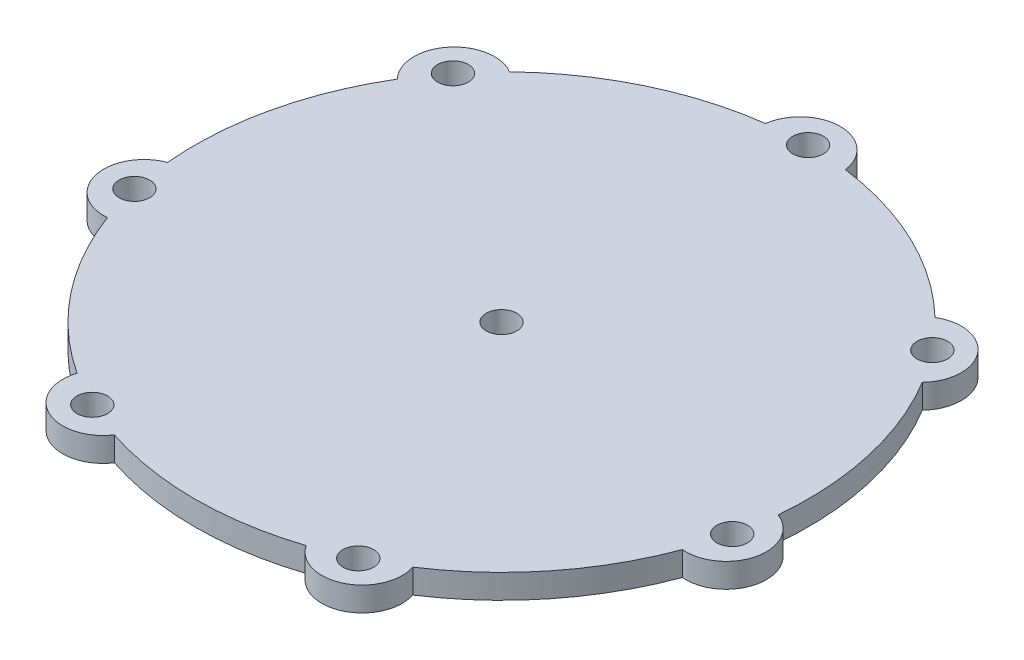
from build123d import *

# Parameters (mm, degrees)
SKETCH1_R           = 38
BOSS_EXTRUDE6_DEPTH = 7
SKETCH3_R           = 38
SKETCH3_R_2         = 35
BOSS_EXTRUDE7_DEPTH = 24
CIRPATTERN1_COUNT   = 24
BOSS_EXTRUDE8_DEPTH = 31
SKETCH6_3_R         = 1.9
CUT_EXTRUDE1_DEPTH  = 31
CIRPATTERN2_COUNT   = 7
BOSS_EXTRUDE9_DEPTH = 7
SKETCH8_R           = 1.9
CUT_EXTRUDE2_DEPTH  = 14
SKETCH9_R           = 42
PART1_DEPTH         = 28


with BuildPart() as part:
    # Sketch1 → Boss-Extrude6 (new body)
    with BuildSketch(Plane(origin=(0, 0, 0), x_dir=(1, 0, 0), z_dir=(0, 1, 0))):
        with Locations(Location((0, 0, 0), (0, 0, 270))):
            Circle(SKETCH1_R)
    extrude(amount=BOSS_EXTRUDE6_DEPTH)

    # Sketch3 → Boss-Extrude7 (add)
    with BuildSketch(Plane(origin=(0, 7, 0), x_dir=(1, 0, 0), z_dir=(0, 1, 0))):
        with Locations(Location((0, 0, 0), (0, 0, 270))):
            Circle(SKETCH3_R)
        with Locations(Location((0, 0, 0), (0, 0, 270))):
            Circle(SKETCH3_R_2, mode=Mode.SUBTRACT)
    extrude(amount=BOSS_EXTRUDE7_DEPTH)

    # Sketch4 → Loft1 section 0
    with BuildSketch(Plane(origin=(0, 7, 0), x_dir=(1, 0, 0), z_dir=(0, 1, 0))):
        with BuildLine():
            Line((1, 33), (-1, 33))
            Line((-1, 33), (-3.355280929, 36))
            Line((-3.355280929, 36), (3.355280929, 36))
            Line((3.355280929, 36), (1, 33))
        make_face()
    # Sketch5 → Loft1 section 1
    with BuildSketch(Plane(origin=(0, 19, 0), x_dir=(0.9889879611668934, 0, 0.147995988685341), z_dir=(0, 1, 0))):
        with BuildLine():
            Line((1, 33), (-1, 33))
            Line((-1, 33), (-3.355280929, 36))
            Line((-3.355280929, 36), (3.355280929, 36))
            Line((3.355280929, 36), (1, 33))
        make_face()
    loft1 = loft()

    # CirPattern1: Loft1 ×24 about axis
    cirpattern1_axis = Axis((0, 7, 0), (0, -1, 0))
    for i in range(1, CIRPATTERN1_COUNT):
        add(loft1.rotate(cirpattern1_axis, i * 360 / CIRPATTERN1_COUNT))

    # Mirror1: read off the stored shape, not the designer's step
    # Mirror1: loft between two sections, ruled curve by curve
    mirror1_from = [
        Edge.make_bspline([(-1, 31, -33), (-0.666666667, 31, -33), (-0.333333333, 31, -33), (0.333333333, 31, -33), (0.666666667, 31, -33), (1, 31, -33)], [0, 0, 0, 0, 0.5, 0.5, 1, 1, 1, 1], 3),
        Edge.make_bspline([(1, 31, -33), (1.392546821, 31, -33.5), (1.785093643, 31, -34), (2.570187286, 31, -35), (2.962734107, 31, -35.5), (3.355280929, 31, -36)], [0, 0, 0, 0, 0.5, 0.5, 1, 1, 1, 1], 3),
        Edge.make_bspline([(-3.355280929, 31, -36), (-2.962734107, 31, -35.5), (-2.570187286, 31, -35), (-1.785093643, 31, -34), (-1.392546821, 31, -33.5), (-1, 31, -33)], [0, 0, 0, 0, 0.5, 0.5, 1, 1, 1, 1], 3),
        Edge.make_line((-3.355280929, 31, -36), (3.355280929, 31, -36)),
    ]
    mirror1_to = [
        Edge.make_bspline([(3.894879665, 19, -32.784598707), (4.224542319, 19, -32.735266711), (4.554204973, 19, -32.685934715), (5.21353028, 19, -32.587270722), (5.543192934, 19, -32.537938726), (5.872855588, 19, -32.48860673)], [0, 0, 0, 0, 0.5, 0.5, 1, 1, 1, 1], 3),
        Edge.make_bspline([(5.872855588, 19, -32.48860673), (6.335077663, 19, -32.925005355), (6.797299738, 19, -33.361403981), (7.721743888, 19, -34.234201232), (8.183965962, 19, -34.670599858), (8.646188037, 19, -35.106998484)], [0, 0, 0, 0, 0.5, 0.5, 1, 1, 1, 1], 3),
        Edge.make_bspline([(2.009523148, 19, -36.10013472), (2.323749234, 19, -35.547545385), (2.63797532, 19, -34.994956049), (3.266427493, 19, -33.889777378), (3.580653579, 19, -33.337188043), (3.894879665, 19, -32.784598707)], [0, 0, 0, 0, 0.5, 0.5, 1, 1, 1, 1], 3),
        Edge.make_line((2.009523148, 19, -36.10013472), (8.646188037, 19, -35.106998484)),
    ]
    mirror1 = Solid(Shell([*[Face.make_surface_from_curves(mirror1_from[k], mirror1_to[k]) for k in range(4)], Face(Wire(mirror1_from)), Face(Wire(mirror1_to))]))
    add(mirror1)

    # Mirror1 2: loft between two sections, ruled curve by curve
    mirror1_2_from = [
        Edge.make_bspline([(7.575102662, 31, -32.134371313), (7.897077938, 31, -32.048098298), (8.219053213, 31, -31.961825283), (8.863003764, 31, -31.789279253), (9.184979039, 31, -31.703006237), (9.506954315, 31, -31.616733222)], [0, 0, 0, 0, 0.5, 0.5, 1, 1, 1, 1], 3),
        Edge.make_bspline([(9.506954315, 31, -31.616733222), (10.01553495, 31, -31.998097542), (10.524115585, 31, -32.379461862), (11.541276856, 31, -33.142190501), (12.049857492, 31, -33.523554821), (12.558438127, 31, -33.90491914)], [0, 0, 0, 0, 0.5, 0.5, 1, 1, 1, 1], 3),
        Edge.make_bspline([(6.07653312, 31, -35.641740352), (6.326294711, 31, -35.057178846), (6.576056301, 31, -34.472617339), (7.075579481, 31, -33.303494326), (7.325341072, 31, -32.718932819), (7.575102662, 31, -32.134371313)], [0, 0, 0, 0, 0.5, 0.5, 1, 1, 1, 1], 3),
        Edge.make_line((6.07653312, 31, -35.641740352), (12.558438127, 31, -33.90491914)),
    ]
    mirror1_2_to = [
        Edge.make_bspline([(12.247443391, 19, -30.65942156), (12.553105002, 19, -30.526447538), (12.858766613, 19, -30.393473515), (13.470089835, 19, -30.12752547), (13.775751446, 19, -29.994551448), (14.081413057, 19, -29.861577425)], [0, 0, 0, 0, 0.5, 0.5, 1, 1, 1, 1], 3),
        Edge.make_bspline([(14.081413057, 19, -29.861577425), (14.640833572, 19, -30.163474252), (15.200254087, 19, -30.465371079), (16.319095118, 19, -31.069164733), (16.878515633, 19, -31.37106156), (17.437936148, 19, -31.672958387)], [0, 0, 0, 0, 0.5, 0.5, 1, 1, 1, 1], 3),
        Edge.make_bspline([(11.284452703, 19, -34.349949597), (11.444951151, 19, -33.734861591), (11.605449599, 19, -33.119773584), (11.926446495, 19, -31.889597572), (12.086944943, 19, -31.274509566), (12.247443391, 19, -30.65942156)], [0, 0, 0, 0, 0.5, 0.5, 1, 1, 1, 1], 3),
        Edge.make_line((11.284452703, 19, -34.349949597), (17.437936148, 19, -31.672958387)),
    ]
    mirror1_2 = Solid(Shell([*[Face.make_surface_from_curves(mirror1_2_from[k], mirror1_2_to[k]) for k in range(4)], Face(Wire(mirror1_2_from)), Face(Wire(mirror1_2_to))]))
    add(mirror1_2)

    # Mirror1 3: loft between two sections, ruled curve by curve
    mirror1_3_from = [
        Edge.make_bspline([(15.633974596, 31, -29.078838325), (15.922649731, 31, -28.912171658), (16.211324865, 31, -28.745504992), (16.788675135, 31, -28.412171658), (17.077350269, 31, -28.245504992), (17.366025404, 31, -28.078838325)], [0, 0, 0, 0, 0.5, 0.5, 1, 1, 1, 1], 3),
        Edge.make_bspline([(17.366025404, 31, -28.078838325), (17.955980923, 31, -28.315577616), (18.545936443, 31, -28.552316907), (19.725847482, 31, -29.02579549), (20.315803002, 31, -29.262534781), (20.905758521, 31, -29.499274072)], [0, 0, 0, 0, 0.5, 0.5, 1, 1, 1, 1], 3),
        Edge.make_bspline([(15.094241479, 31, -32.854555001), (15.184196998, 31, -32.225268888), (15.274152518, 31, -31.595982775), (15.454063557, 31, -30.33741055), (15.544019077, 31, -29.708124437), (15.633974596, 31, -29.078838325)], [0, 0, 0, 0, 0.5, 0.5, 1, 1, 1, 1], 3),
        Edge.make_line((15.094241479, 31, -32.854555001), (20.905758521, 31, -29.499274072)),
    ]
    mirror1_3_to = [
        Edge.make_bspline([(19.765364089, 19, -26.444855501), (20.026194323, 19, -26.237301412), (20.287024558, 19, -26.029747323), (20.808685027, 19, -25.614639145), (21.069515262, 19, -25.407085057), (21.330345497, 19, -25.199530968)], [0, 0, 0, 0, 0.5, 0.5, 1, 1, 1, 1], 3),
        Edge.make_bspline([(21.330345497, 19, -25.199530968), (21.948840869, 19, -25.346352226), (22.567336241, 19, -25.493173485), (23.804326984, 19, -25.786816002), (24.422822356, 19, -25.93363726), (25.041317728, 19, -26.080458519)], [0, 0, 0, 0, 0.5, 0.5, 1, 1, 1, 1], 3),
        Edge.make_bspline([(19.790365456, 19, -30.258872174), (19.786198561, 19, -29.623202728), (19.782031667, 19, -28.987533283), (19.773697878, 19, -27.716194392), (19.769530983, 19, -27.080524946), (19.765364089, 19, -26.444855501)], [0, 0, 0, 0, 0.5, 0.5, 1, 1, 1, 1], 3),
        Edge.make_line((19.790365456, 19, -30.258872174), (25.041317728, 19, -26.080458519)),
    ]
    mirror1_3 = Solid(Shell([*[Face.make_surface_from_curves(mirror1_3_from[k], mirror1_3_to[k]) for k in range(4)], Face(Wire(mirror1_3_from)), Face(Wire(mirror1_3_to))]))
    add(mirror1_3)

    # Mirror1 4: loft between two sections, ruled curve by curve
    mirror1_4_from = [
        Edge.make_bspline([(22.627416998, 31, -24.04163056), (22.863119258, 31, -23.8059283), (23.098821519, 31, -23.57022604), (23.57022604, 31, -23.098821519), (23.8059283, 31, -22.863119258), (24.04163056, 31, -22.627416998)], [0, 0, 0, 0, 0.5, 0.5, 1, 1, 1, 1], 3),
        Edge.make_bspline([(24.04163056, 31, -22.627416998), (24.67275647, 31, -22.703397869), (25.30388238, 31, -22.77937874), (26.5661342, 31, -22.931340483), (27.19726011, 31, -23.007321354), (27.82838602, 31, -23.083302225)], [0, 0, 0, 0, 0.5, 0.5, 1, 1, 1, 1], 3),
        Edge.make_bspline([(23.083302225, 31, -27.82838602), (23.007321354, 31, -27.19726011), (22.931340483, 31, -26.5661342), (22.77937874, 31, -25.30388238), (22.703397869, 31, -24.67275647), (22.627416998, 31, -24.04163056)], [0, 0, 0, 0, 0.5, 0.5, 1, 1, 1, 1], 3),
        Edge.make_line((23.083302225, 31, -27.82838602), (27.82838602, 31, -23.083302225)),
    ]
    mirror1_4_to = [
        Edge.make_bspline([(25.936307888, 19, -20.428116241), (26.134531597, 19, -20.160126554), (26.332755305, 19, -19.892136867), (26.729202723, 19, -19.356157493), (26.927426432, 19, -19.088167806), (27.125650141, 19, -18.820178119)], [0, 0, 0, 0, 0.5, 0.5, 1, 1, 1, 1], 3),
        Edge.make_bspline([(27.125650141, 19, -18.820178119), (27.761070932, 19, -18.801918183), (28.396491723, 19, -18.783658247), (29.667333305, 19, -18.747138374), (30.302754096, 19, -18.728878438), (30.938174888, 19, -18.710618502)], [0, 0, 0, 0, 0.5, 0.5, 1, 1, 1, 1], 3),
        Edge.make_bspline([(26.947597507, 19, -24.105702618), (26.779049237, 19, -23.492771555), (26.610500967, 19, -22.879840492), (26.273404428, 19, -21.653978367), (26.104856158, 19, -21.041047304), (25.936307888, 19, -20.428116241)], [0, 0, 0, 0, 0.5, 0.5, 1, 1, 1, 1], 3),
        Edge.make_line((26.947597507, 19, -24.105702618), (30.938174888, 19, -18.710618502)),
    ]
    mirror1_4 = Solid(Shell([*[Face.make_surface_from_curves(mirror1_4_from[k], mirror1_4_to[k]) for k in range(4)], Face(Wire(mirror1_4_from)), Face(Wire(mirror1_4_to))]))
    add(mirror1_4)

    # Mirror1 5: loft between two sections, ruled curve by curve
    mirror1_5_from = [
        Edge.make_bspline([(28.078838325, 31, -17.366025404), (28.245504992, 31, -17.077350269), (28.412171658, 31, -16.788675135), (28.745504992, 31, -16.211324865), (28.912171658, 31, -15.922649731), (29.078838325, 31, -15.633974596)], [0, 0, 0, 0, 0.5, 0.5, 1, 1, 1, 1], 3),
        Edge.make_bspline([(29.078838325, 31, -15.633974596), (29.708124437, 31, -15.544019077), (30.33741055, 31, -15.454063557), (31.595982775, 31, -15.274152518), (32.225268888, 31, -15.184196998), (32.854555001, 31, -15.094241479)], [0, 0, 0, 0, 0.5, 0.5, 1, 1, 1, 1], 3),
        Edge.make_bspline([(29.499274072, 31, -20.905758521), (29.262534781, 31, -20.315803002), (29.02579549, 31, -19.725847482), (28.552316907, 31, -18.545936443), (28.315577616, 31, -17.955980923), (28.078838325, 31, -17.366025404)], [0, 0, 0, 0, 0.5, 0.5, 1, 1, 1, 1], 3),
        Edge.make_line((29.499274072, 31, -20.905758521), (32.854555001, 31, -15.094241479)),
    ]
    mirror1_5_to = [
        Edge.make_bspline([(30.339735166, 19, -13.019234619), (30.461843731, 19, -12.709072388), (30.583952296, 19, -12.398910157), (30.828169426, 19, -11.778585695), (30.950277991, 19, -11.468423464), (31.072386555, 19, -11.158261233)], [0, 0, 0, 0, 0.5, 0.5, 1, 1, 1, 1], 3),
        Edge.make_bspline([(31.072386555, 19, -11.158261233), (31.681429889, 19, -10.976164487), (32.290473222, 19, -10.794067741), (33.508559889, 19, -10.429874248), (34.117603223, 19, -10.247777502), (34.726646556, 19, -10.065680756)], [0, 0, 0, 0, 0.5, 0.5, 1, 1, 1, 1], 3),
        Edge.make_bspline([(32.268395322, 19, -16.309769265), (31.946951963, 19, -15.761346824), (31.625508603, 19, -15.212924383), (30.982621885, 19, -14.116079501), (30.661178525, 19, -13.56765706), (30.339735166, 19, -13.019234619)], [0, 0, 0, 0, 0.5, 0.5, 1, 1, 1, 1], 3),
        Edge.make_line((32.268395322, 19, -16.309769265), (34.726646556, 19, -10.065680756)),
    ]
    mirror1_5 = Solid(Shell([*[Face.make_surface_from_curves(mirror1_5_from[k], mirror1_5_to[k]) for k in range(4)], Face(Wire(mirror1_5_from)), Face(Wire(mirror1_5_to))]))
    add(mirror1_5)

    # Mirror1 6: loft between two sections, ruled curve by curve
    mirror1_6_from = [
        Edge.make_bspline([(31.616733222, 31, -9.506954315), (31.703006237, 31, -9.184979039), (31.789279253, 31, -8.863003764), (31.961825283, 31, -8.219053213), (32.048098298, 31, -7.897077938), (32.134371313, 31, -7.575102662)], [0, 0, 0, 0, 0.5, 0.5, 1, 1, 1, 1], 3),
        Edge.make_bspline([(32.134371313, 31, -7.575102662), (32.718932819, 31, -7.325341072), (33.303494326, 31, -7.075579481), (34.472617339, 31, -6.576056301), (35.057178846, 31, -6.326294711), (35.641740352, 31, -6.07653312)], [0, 0, 0, 0, 0.5, 0.5, 1, 1, 1, 1], 3),
        Edge.make_bspline([(33.90491914, 31, -12.558438127), (33.523554821, 31, -12.049857492), (33.142190501, 31, -11.541276856), (32.379461862, 31, -10.524115585), (31.998097542, 31, -10.01553495), (31.616733222, 31, -9.506954315)], [0, 0, 0, 0, 0.5, 0.5, 1, 1, 1, 1], 3),
        Edge.make_line((33.90491914, 31, -12.558438127), (35.641740352, 31, -6.07653312)),
    ]
    mirror1_6_to = [
        Edge.make_bspline([(32.675559632, 19, -4.723113672), (32.713231556, 19, -4.391915941), (32.75090348, 19, -4.06071821), (32.826247328, 19, -3.398322747), (32.863919252, 19, -3.067125016), (32.901591176, 19, -2.735927284)], [0, 0, 0, 0, 0.5, 0.5, 1, 1, 1, 1], 3),
        Edge.make_bspline([(32.901591176, 19, -2.735927284), (33.442751755, 19, -2.40240332), (33.983912334, 19, -2.068879356), (35.066233492, 19, -1.401831428), (35.607394071, 19, -1.068307464), (36.14855465, 19, -0.7347835)], [0, 0, 0, 0, 0.5, 0.5, 1, 1, 1, 1], 3),
        Edge.make_bspline([(35.390155321, 19, -7.402352089), (34.937722706, 19, -6.955812353), (34.485290091, 19, -6.509272617), (33.580424861, 19, -5.616193145), (33.127992247, 19, -5.169653408), (32.675559632, 19, -4.723113672)], [0, 0, 0, 0, 0.5, 0.5, 1, 1, 1, 1], 3),
        Edge.make_line((35.390155321, 19, -7.402352089), (36.14855465, 19, -0.7347835)),
    ]
    mirror1_6 = Solid(Shell([*[Face.make_surface_from_curves(mirror1_6_from[k], mirror1_6_to[k]) for k in range(4)], Face(Wire(mirror1_6_from)), Face(Wire(mirror1_6_to))]))
    add(mirror1_6)

    # Mirror1 7: loft between two sections, ruled curve by curve
    mirror1_7_from = [
        Edge.make_bspline([(33, 31, -1), (33, 31, -0.666666667), (33, 31, -0.333333333), (33, 31, 0.333333333), (33, 31, 0.666666667), (33, 31, 1)], [0, 0, 0, 0, 0.5, 0.5, 1, 1, 1, 1], 3),
        Edge.make_bspline([(33, 31, 1), (33.5, 31, 1.392546821), (34, 31, 1.785093643), (35, 31, 2.570187286), (35.5, 31, 2.962734107), (36, 31, 3.355280929)], [0, 0, 0, 0, 0.5, 0.5, 1, 1, 1, 1], 3),
        Edge.make_bspline([(36, 31, -3.355280929), (35.5, 31, -2.962734107), (35, 31, -2.570187286), (34, 31, -1.785093643), (33.5, 31, -1.392546821), (33, 31, -1)], [0, 0, 0, 0, 0.5, 0.5, 1, 1, 1, 1], 3),
        Edge.make_line((36, 31, -3.355280929), (36, 31, 3.355280929)),
    ]
    mirror1_7_to = [
        Edge.make_bspline([(32.784598707, 19, 3.894879665), (32.735266711, 19, 4.224542319), (32.685934715, 19, 4.554204973), (32.587270722, 19, 5.21353028), (32.537938726, 19, 5.543192934), (32.48860673, 19, 5.872855588)], [0, 0, 0, 0, 0.5, 0.5, 1, 1, 1, 1], 3),
        Edge.make_bspline([(32.48860673, 19, 5.872855588), (32.925005355, 19, 6.335077663), (33.361403981, 19, 6.797299738), (34.234201232, 19, 7.721743888), (34.670599858, 19, 8.183965962), (35.106998484, 19, 8.646188037)], [0, 0, 0, 0, 0.5, 0.5, 1, 1, 1, 1], 3),
        Edge.make_bspline([(36.10013472, 19, 2.009523148), (35.547545385, 19, 2.323749234), (34.994956049, 19, 2.63797532), (33.889777378, 19, 3.266427493), (33.337188043, 19, 3.580653579), (32.784598707, 19, 3.894879665)], [0, 0, 0, 0, 0.5, 0.5, 1, 1, 1, 1], 3),
        Edge.make_line((36.10013472, 19, 2.009523148), (35.106998484, 19, 8.646188037)),
    ]
    mirror1_7 = Solid(Shell([*[Face.make_surface_from_curves(mirror1_7_from[k], mirror1_7_to[k]) for k in range(4)], Face(Wire(mirror1_7_from)), Face(Wire(mirror1_7_to))]))
    add(mirror1_7)

    # Mirror1 8: loft between two sections, ruled curve by curve
    mirror1_8_from = [
        Edge.make_bspline([(32.134371313, 31, 7.575102662), (32.048098298, 31, 7.897077938), (31.961825283, 31, 8.219053213), (31.789279253, 31, 8.863003764), (31.703006237, 31, 9.184979039), (31.616733222, 31, 9.506954315)], [0, 0, 0, 0, 0.5, 0.5, 1, 1, 1, 1], 3),
        Edge.make_bspline([(31.616733222, 31, 9.506954315), (31.998097542, 31, 10.01553495), (32.379461862, 31, 10.524115585), (33.142190501, 31, 11.541276856), (33.523554821, 31, 12.049857492), (33.90491914, 31, 12.558438127)], [0, 0, 0, 0, 0.5, 0.5, 1, 1, 1, 1], 3),
        Edge.make_bspline([(35.641740352, 31, 6.07653312), (35.057178846, 31, 6.326294711), (34.472617339, 31, 6.576056301), (33.303494326, 31, 7.075579481), (32.718932819, 31, 7.325341072), (32.134371313, 31, 7.575102662)], [0, 0, 0, 0, 0.5, 0.5, 1, 1, 1, 1], 3),
        Edge.make_line((35.641740352, 31, 6.07653312), (33.90491914, 31, 12.558438127)),
    ]
    mirror1_8_to = [
        Edge.make_bspline([(30.65942156, 19, 12.247443391), (30.526447538, 19, 12.553105002), (30.393473515, 19, 12.858766613), (30.12752547, 19, 13.470089835), (29.994551448, 19, 13.775751446), (29.861577425, 19, 14.081413057)], [0, 0, 0, 0, 0.5, 0.5, 1, 1, 1, 1], 3),
        Edge.make_bspline([(29.861577425, 19, 14.081413057), (30.163474252, 19, 14.640833572), (30.465371079, 19, 15.200254087), (31.069164733, 19, 16.319095118), (31.37106156, 19, 16.878515633), (31.672958387, 19, 17.437936148)], [0, 0, 0, 0, 0.5, 0.5, 1, 1, 1, 1], 3),
        Edge.make_bspline([(34.349949597, 19, 11.284452703), (33.734861591, 19, 11.444951151), (33.119773584, 19, 11.605449599), (31.889597572, 19, 11.926446495), (31.274509566, 19, 12.086944943), (30.65942156, 19, 12.247443391)], [0, 0, 0, 0, 0.5, 0.5, 1, 1, 1, 1], 3),
        Edge.make_line((34.349949597, 19, 11.284452703), (31.672958387, 19, 17.437936148)),
    ]
    mirror1_8 = Solid(Shell([*[Face.make_surface_from_curves(mirror1_8_from[k], mirror1_8_to[k]) for k in range(4)], Face(Wire(mirror1_8_from)), Face(Wire(mirror1_8_to))]))
    add(mirror1_8)

    # Mirror1 9: loft between two sections, ruled curve by curve
    mirror1_9_from = [
        Edge.make_bspline([(29.078838325, 31, 15.633974596), (28.912171658, 31, 15.922649731), (28.745504992, 31, 16.211324865), (28.412171658, 31, 16.788675135), (28.245504992, 31, 17.077350269), (28.078838325, 31, 17.366025404)], [0, 0, 0, 0, 0.5, 0.5, 1, 1, 1, 1], 3),
        Edge.make_bspline([(28.078838325, 31, 17.366025404), (28.315577616, 31, 17.955980923), (28.552316907, 31, 18.545936443), (29.02579549, 31, 19.725847482), (29.262534781, 31, 20.315803002), (29.499274072, 31, 20.905758521)], [0, 0, 0, 0, 0.5, 0.5, 1, 1, 1, 1], 3),
        Edge.make_bspline([(32.854555001, 31, 15.094241479), (32.225268888, 31, 15.184196998), (31.595982775, 31, 15.274152518), (30.33741055, 31, 15.454063557), (29.708124437, 31, 15.544019077), (29.078838325, 31, 15.633974596)], [0, 0, 0, 0, 0.5, 0.5, 1, 1, 1, 1], 3),
        Edge.make_line((32.854555001, 31, 15.094241479), (29.499274072, 31, 20.905758521)),
    ]
    mirror1_9_to = [
        Edge.make_bspline([(26.444855501, 19, 19.765364089), (26.237301412, 19, 20.026194323), (26.029747323, 19, 20.287024558), (25.614639145, 19, 20.808685027), (25.407085057, 19, 21.069515262), (25.199530968, 19, 21.330345497)], [0, 0, 0, 0, 0.5, 0.5, 1, 1, 1, 1], 3),
        Edge.make_bspline([(25.199530968, 19, 21.330345497), (25.346352226, 19, 21.948840869), (25.493173485, 19, 22.567336241), (25.786816002, 19, 23.804326984), (25.93363726, 19, 24.422822356), (26.080458519, 19, 25.041317728)], [0, 0, 0, 0, 0.5, 0.5, 1, 1, 1, 1], 3),
        Edge.make_bspline([(30.258872174, 19, 19.790365456), (29.623202728, 19, 19.786198561), (28.987533283, 19, 19.782031667), (27.716194392, 19, 19.773697878), (27.080524946, 19, 19.769530983), (26.444855501, 19, 19.765364089)], [0, 0, 0, 0, 0.5, 0.5, 1, 1, 1, 1], 3),
        Edge.make_line((30.258872174, 19, 19.790365456), (26.080458519, 19, 25.041317728)),
    ]
    mirror1_9 = Solid(Shell([*[Face.make_surface_from_curves(mirror1_9_from[k], mirror1_9_to[k]) for k in range(4)], Face(Wire(mirror1_9_from)), Face(Wire(mirror1_9_to))]))
    add(mirror1_9)

    # Mirror1 10: loft between two sections, ruled curve by curve
    mirror1_10_from = [
        Edge.make_bspline([(24.04163056, 31, 22.627416998), (23.8059283, 31, 22.863119258), (23.57022604, 31, 23.098821519), (23.098821519, 31, 23.57022604), (22.863119258, 31, 23.8059283), (22.627416998, 31, 24.04163056)], [0, 0, 0, 0, 0.5, 0.5, 1, 1, 1, 1], 3),
        Edge.make_bspline([(22.627416998, 31, 24.04163056), (22.703397869, 31, 24.67275647), (22.77937874, 31, 25.30388238), (22.931340483, 31, 26.5661342), (23.007321354, 31, 27.19726011), (23.083302225, 31, 27.82838602)], [0, 0, 0, 0, 0.5, 0.5, 1, 1, 1, 1], 3),
        Edge.make_bspline([(27.82838602, 31, 23.083302225), (27.19726011, 31, 23.007321354), (26.5661342, 31, 22.931340483), (25.30388238, 31, 22.77937874), (24.67275647, 31, 22.703397869), (24.04163056, 31, 22.627416998)], [0, 0, 0, 0, 0.5, 0.5, 1, 1, 1, 1], 3),
        Edge.make_line((27.82838602, 31, 23.083302225), (23.083302225, 31, 27.82838602)),
    ]
    mirror1_10_to = [
        Edge.make_bspline([(20.428116241, 19, 25.936307888), (20.160126554, 19, 26.134531597), (19.892136867, 19, 26.332755305), (19.356157493, 19, 26.729202723), (19.088167806, 19, 26.927426432), (18.820178119, 19, 27.125650141)], [0, 0, 0, 0, 0.5, 0.5, 1, 1, 1, 1], 3),
        Edge.make_bspline([(18.820178119, 19, 27.125650141), (18.801918183, 19, 27.761070932), (18.783658247, 19, 28.396491723), (18.747138374, 19, 29.667333305), (18.728878438, 19, 30.302754096), (18.710618502, 19, 30.938174888)], [0, 0, 0, 0, 0.5, 0.5, 1, 1, 1, 1], 3),
        Edge.make_bspline([(24.105702618, 19, 26.947597507), (23.492771555, 19, 26.779049237), (22.879840492, 19, 26.610500967), (21.653978367, 19, 26.273404428), (21.041047304, 19, 26.104856158), (20.428116241, 19, 25.936307888)], [0, 0, 0, 0, 0.5, 0.5, 1, 1, 1, 1], 3),
        Edge.make_line((24.105702618, 19, 26.947597507), (18.710618502, 19, 30.938174888)),
    ]
    mirror1_10 = Solid(Shell([*[Face.make_surface_from_curves(mirror1_10_from[k], mirror1_10_to[k]) for k in range(4)], Face(Wire(mirror1_10_from)), Face(Wire(mirror1_10_to))]))
    add(mirror1_10)

    # Mirror1 11: loft between two sections, ruled curve by curve
    mirror1_11_from = [
        Edge.make_bspline([(17.366025404, 31, 28.078838325), (17.077350269, 31, 28.245504992), (16.788675135, 31, 28.412171658), (16.211324865, 31, 28.745504992), (15.922649731, 31, 28.912171658), (15.633974596, 31, 29.078838325)], [0, 0, 0, 0, 0.5, 0.5, 1, 1, 1, 1], 3),
        Edge.make_bspline([(15.633974596, 31, 29.078838325), (15.544019077, 31, 29.708124437), (15.454063557, 31, 30.33741055), (15.274152518, 31, 31.595982775), (15.184196998, 31, 32.225268888), (15.094241479, 31, 32.854555001)], [0, 0, 0, 0, 0.5, 0.5, 1, 1, 1, 1], 3),
        Edge.make_bspline([(20.905758521, 31, 29.499274072), (20.315803002, 31, 29.262534781), (19.725847482, 31, 29.02579549), (18.545936443, 31, 28.552316907), (17.955980923, 31, 28.315577616), (17.366025404, 31, 28.078838325)], [0, 0, 0, 0, 0.5, 0.5, 1, 1, 1, 1], 3),
        Edge.make_line((20.905758521, 31, 29.499274072), (15.094241479, 31, 32.854555001)),
    ]
    mirror1_11_to = [
        Edge.make_bspline([(13.019234619, 19, 30.339735166), (12.709072388, 19, 30.461843731), (12.398910157, 19, 30.583952296), (11.778585695, 19, 30.828169426), (11.468423464, 19, 30.950277991), (11.158261233, 19, 31.072386555)], [0, 0, 0, 0, 0.5, 0.5, 1, 1, 1, 1], 3),
        Edge.make_bspline([(11.158261233, 19, 31.072386555), (10.976164487, 19, 31.681429889), (10.794067741, 19, 32.290473222), (10.429874248, 19, 33.508559889), (10.247777502, 19, 34.117603223), (10.065680756, 19, 34.726646556)], [0, 0, 0, 0, 0.5, 0.5, 1, 1, 1, 1], 3),
        Edge.make_bspline([(16.309769265, 19, 32.268395322), (15.761346824, 19, 31.946951963), (15.212924383, 19, 31.625508603), (14.116079501, 19, 30.982621885), (13.56765706, 19, 30.661178525), (13.019234619, 19, 30.339735166)], [0, 0, 0, 0, 0.5, 0.5, 1, 1, 1, 1], 3),
        Edge.make_line((16.309769265, 19, 32.268395322), (10.065680756, 19, 34.726646556)),
    ]
    mirror1_11 = Solid(Shell([*[Face.make_surface_from_curves(mirror1_11_from[k], mirror1_11_to[k]) for k in range(4)], Face(Wire(mirror1_11_from)), Face(Wire(mirror1_11_to))]))
    add(mirror1_11)

    # Mirror1 12: loft between two sections, ruled curve by curve
    mirror1_12_from = [
        Edge.make_bspline([(9.506954315, 31, 31.616733222), (9.184979039, 31, 31.703006237), (8.863003764, 31, 31.789279253), (8.219053213, 31, 31.961825283), (7.897077938, 31, 32.048098298), (7.575102662, 31, 32.134371313)], [0, 0, 0, 0, 0.5, 0.5, 1, 1, 1, 1], 3),
        Edge.make_bspline([(7.575102662, 31, 32.134371313), (7.325341072, 31, 32.718932819), (7.075579481, 31, 33.303494326), (6.576056301, 31, 34.472617339), (6.326294711, 31, 35.057178846), (6.07653312, 31, 35.641740352)], [0, 0, 0, 0, 0.5, 0.5, 1, 1, 1, 1], 3),
        Edge.make_bspline([(12.558438127, 31, 33.90491914), (12.049857492, 31, 33.523554821), (11.541276856, 31, 33.142190501), (10.524115585, 31, 32.379461862), (10.01553495, 31, 31.998097542), (9.506954315, 31, 31.616733222)], [0, 0, 0, 0, 0.5, 0.5, 1, 1, 1, 1], 3),
        Edge.make_line((12.558438127, 31, 33.90491914), (6.07653312, 31, 35.641740352)),
    ]
    mirror1_12_to = [
        Edge.make_bspline([(4.723113672, 19, 32.675559632), (4.391915941, 19, 32.713231556), (4.06071821, 19, 32.75090348), (3.398322747, 19, 32.826247328), (3.067125016, 19, 32.863919252), (2.735927284, 19, 32.901591176)], [0, 0, 0, 0, 0.5, 0.5, 1, 1, 1, 1], 3),
        Edge.make_bspline([(2.735927284, 19, 32.901591176), (2.40240332, 19, 33.442751755), (2.068879356, 19, 33.983912334), (1.401831428, 19, 35.066233492), (1.068307464, 19, 35.607394071), (0.7347835, 19, 36.14855465)], [0, 0, 0, 0, 0.5, 0.5, 1, 1, 1, 1], 3),
        Edge.make_bspline([(7.402352089, 19, 35.390155321), (6.955812353, 19, 34.937722706), (6.509272617, 19, 34.485290091), (5.616193145, 19, 33.580424861), (5.169653408, 19, 33.127992247), (4.723113672, 19, 32.675559632)], [0, 0, 0, 0, 0.5, 0.5, 1, 1, 1, 1], 3),
        Edge.make_line((7.402352089, 19, 35.390155321), (0.7347835, 19, 36.14855465)),
    ]
    mirror1_12 = Solid(Shell([*[Face.make_surface_from_curves(mirror1_12_from[k], mirror1_12_to[k]) for k in range(4)], Face(Wire(mirror1_12_from)), Face(Wire(mirror1_12_to))]))
    add(mirror1_12)

    # Mirror1 13: loft between two sections, ruled curve by curve
    mirror1_13_from = [
        Edge.make_bspline([(1, 31, 33), (0.666666667, 31, 33), (0.333333333, 31, 33), (-0.333333333, 31, 33), (-0.666666667, 31, 33), (-1, 31, 33)], [0, 0, 0, 0, 0.5, 0.5, 1, 1, 1, 1], 3),
        Edge.make_bspline([(-1, 31, 33), (-1.392546821, 31, 33.5), (-1.785093643, 31, 34), (-2.570187286, 31, 35), (-2.962734107, 31, 35.5), (-3.355280929, 31, 36)], [0, 0, 0, 0, 0.5, 0.5, 1, 1, 1, 1], 3),
        Edge.make_bspline([(3.355280929, 31, 36), (2.962734107, 31, 35.5), (2.570187286, 31, 35), (1.785093643, 31, 34), (1.392546821, 31, 33.5), (1, 31, 33)], [0, 0, 0, 0, 0.5, 0.5, 1, 1, 1, 1], 3),
        Edge.make_line((3.355280929, 31, 36), (-3.355280929, 31, 36)),
    ]
    mirror1_13_to = [
        Edge.make_bspline([(-3.894879665, 19, 32.784598707), (-4.224542319, 19, 32.735266711), (-4.554204973, 19, 32.685934715), (-5.21353028, 19, 32.587270722), (-5.543192934, 19, 32.537938726), (-5.872855588, 19, 32.48860673)], [0, 0, 0, 0, 0.5, 0.5, 1, 1, 1, 1], 3),
        Edge.make_bspline([(-5.872855588, 19, 32.48860673), (-6.335077663, 19, 32.925005355), (-6.797299738, 19, 33.361403981), (-7.721743888, 19, 34.234201232), (-8.183965962, 19, 34.670599858), (-8.646188037, 19, 35.106998484)], [0, 0, 0, 0, 0.5, 0.5, 1, 1, 1, 1], 3),
        Edge.make_bspline([(-2.009523148, 19, 36.10013472), (-2.323749234, 19, 35.547545385), (-2.63797532, 19, 34.994956049), (-3.266427493, 19, 33.889777378), (-3.580653579, 19, 33.337188043), (-3.894879665, 19, 32.784598707)], [0, 0, 0, 0, 0.5, 0.5, 1, 1, 1, 1], 3),
        Edge.make_line((-2.009523148, 19, 36.10013472), (-8.646188037, 19, 35.106998484)),
    ]
    mirror1_13 = Solid(Shell([*[Face.make_surface_from_curves(mirror1_13_from[k], mirror1_13_to[k]) for k in range(4)], Face(Wire(mirror1_13_from)), Face(Wire(mirror1_13_to))]))
    add(mirror1_13)

    # Mirror1 14: loft between two sections, ruled curve by curve
    mirror1_14_from = [
        Edge.make_bspline([(-7.575102662, 31, 32.134371313), (-7.897077938, 31, 32.048098298), (-8.219053213, 31, 31.961825283), (-8.863003764, 31, 31.789279253), (-9.184979039, 31, 31.703006237), (-9.506954315, 31, 31.616733222)], [0, 0, 0, 0, 0.5, 0.5, 1, 1, 1, 1], 3),
        Edge.make_bspline([(-9.506954315, 31, 31.616733222), (-10.01553495, 31, 31.998097542), (-10.524115585, 31, 32.379461862), (-11.541276856, 31, 33.142190501), (-12.049857492, 31, 33.523554821), (-12.558438127, 31, 33.90491914)], [0, 0, 0, 0, 0.5, 0.5, 1, 1, 1, 1], 3),
        Edge.make_bspline([(-6.07653312, 31, 35.641740352), (-6.326294711, 31, 35.057178846), (-6.576056301, 31, 34.472617339), (-7.075579481, 31, 33.303494326), (-7.325341072, 31, 32.718932819), (-7.575102662, 31, 32.134371313)], [0, 0, 0, 0, 0.5, 0.5, 1, 1, 1, 1], 3),
        Edge.make_line((-6.07653312, 31, 35.641740352), (-12.558438127, 31, 33.90491914)),
    ]
    mirror1_14_to = [
        Edge.make_bspline([(-12.247443391, 19, 30.65942156), (-12.553105002, 19, 30.526447538), (-12.858766613, 19, 30.393473515), (-13.470089835, 19, 30.12752547), (-13.775751446, 19, 29.994551448), (-14.081413057, 19, 29.861577425)], [0, 0, 0, 0, 0.5, 0.5, 1, 1, 1, 1], 3),
        Edge.make_bspline([(-14.081413057, 19, 29.861577425), (-14.640833572, 19, 30.163474252), (-15.200254087, 19, 30.465371079), (-16.319095118, 19, 31.069164733), (-16.878515633, 19, 31.37106156), (-17.437936148, 19, 31.672958387)], [0, 0, 0, 0, 0.5, 0.5, 1, 1, 1, 1], 3),
        Edge.make_bspline([(-11.284452703, 19, 34.349949597), (-11.444951151, 19, 33.734861591), (-11.605449599, 19, 33.119773584), (-11.926446495, 19, 31.889597572), (-12.086944943, 19, 31.274509566), (-12.247443391, 19, 30.65942156)], [0, 0, 0, 0, 0.5, 0.5, 1, 1, 1, 1], 3),
        Edge.make_line((-11.284452703, 19, 34.349949597), (-17.437936148, 19, 31.672958387)),
    ]
    mirror1_14 = Solid(Shell([*[Face.make_surface_from_curves(mirror1_14_from[k], mirror1_14_to[k]) for k in range(4)], Face(Wire(mirror1_14_from)), Face(Wire(mirror1_14_to))]))
    add(mirror1_14)

    # Mirror1 15: loft between two sections, ruled curve by curve
    mirror1_15_from = [
        Edge.make_bspline([(-15.633974596, 31, 29.078838325), (-15.922649731, 31, 28.912171658), (-16.211324865, 31, 28.745504992), (-16.788675135, 31, 28.412171658), (-17.077350269, 31, 28.245504992), (-17.366025404, 31, 28.078838325)], [0, 0, 0, 0, 0.5, 0.5, 1, 1, 1, 1], 3),
        Edge.make_bspline([(-17.366025404, 31, 28.078838325), (-17.955980923, 31, 28.315577616), (-18.545936443, 31, 28.552316907), (-19.725847482, 31, 29.02579549), (-20.315803002, 31, 29.262534781), (-20.905758521, 31, 29.499274072)], [0, 0, 0, 0, 0.5, 0.5, 1, 1, 1, 1], 3),
        Edge.make_bspline([(-15.094241479, 31, 32.854555001), (-15.184196998, 31, 32.225268888), (-15.274152518, 31, 31.595982775), (-15.454063557, 31, 30.33741055), (-15.544019077, 31, 29.708124437), (-15.633974596, 31, 29.078838325)], [0, 0, 0, 0, 0.5, 0.5, 1, 1, 1, 1], 3),
        Edge.make_line((-15.094241479, 31, 32.854555001), (-20.905758521, 31, 29.499274072)),
    ]
    mirror1_15_to = [
        Edge.make_bspline([(-19.765364089, 19, 26.444855501), (-20.026194323, 19, 26.237301412), (-20.287024558, 19, 26.029747323), (-20.808685027, 19, 25.614639145), (-21.069515262, 19, 25.407085057), (-21.330345497, 19, 25.199530968)], [0, 0, 0, 0, 0.5, 0.5, 1, 1, 1, 1], 3),
        Edge.make_bspline([(-21.330345497, 19, 25.199530968), (-21.948840869, 19, 25.346352226), (-22.567336241, 19, 25.493173485), (-23.804326984, 19, 25.786816002), (-24.422822356, 19, 25.93363726), (-25.041317728, 19, 26.080458519)], [0, 0, 0, 0, 0.5, 0.5, 1, 1, 1, 1], 3),
        Edge.make_bspline([(-19.790365456, 19, 30.258872174), (-19.786198561, 19, 29.623202728), (-19.782031667, 19, 28.987533283), (-19.773697878, 19, 27.716194392), (-19.769530983, 19, 27.080524946), (-19.765364089, 19, 26.444855501)], [0, 0, 0, 0, 0.5, 0.5, 1, 1, 1, 1], 3),
        Edge.make_line((-19.790365456, 19, 30.258872174), (-25.041317728, 19, 26.080458519)),
    ]
    mirror1_15 = Solid(Shell([*[Face.make_surface_from_curves(mirror1_15_from[k], mirror1_15_to[k]) for k in range(4)], Face(Wire(mirror1_15_from)), Face(Wire(mirror1_15_to))]))
    add(mirror1_15)

    # Mirror1 16: loft between two sections, ruled curve by curve
    mirror1_16_from = [
        Edge.make_bspline([(-22.627416998, 31, 24.04163056), (-22.863119258, 31, 23.8059283), (-23.098821519, 31, 23.57022604), (-23.57022604, 31, 23.098821519), (-23.8059283, 31, 22.863119258), (-24.04163056, 31, 22.627416998)], [0, 0, 0, 0, 0.5, 0.5, 1, 1, 1, 1], 3),
        Edge.make_bspline([(-24.04163056, 31, 22.627416998), (-24.67275647, 31, 22.703397869), (-25.30388238, 31, 22.77937874), (-26.5661342, 31, 22.931340483), (-27.19726011, 31, 23.007321354), (-27.82838602, 31, 23.083302225)], [0, 0, 0, 0, 0.5, 0.5, 1, 1, 1, 1], 3),
        Edge.make_bspline([(-23.083302225, 31, 27.82838602), (-23.007321354, 31, 27.19726011), (-22.931340483, 31, 26.5661342), (-22.77937874, 31, 25.30388238), (-22.703397869, 31, 24.67275647), (-22.627416998, 31, 24.04163056)], [0, 0, 0, 0, 0.5, 0.5, 1, 1, 1, 1], 3),
        Edge.make_line((-23.083302225, 31, 27.82838602), (-27.82838602, 31, 23.083302225)),
    ]
    mirror1_16_to = [
        Edge.make_bspline([(-25.936307888, 19, 20.428116241), (-26.134531597, 19, 20.160126554), (-26.332755305, 19, 19.892136867), (-26.729202723, 19, 19.356157493), (-26.927426432, 19, 19.088167806), (-27.125650141, 19, 18.820178119)], [0, 0, 0, 0, 0.5, 0.5, 1, 1, 1, 1], 3),
        Edge.make_bspline([(-27.125650141, 19, 18.820178119), (-27.761070932, 19, 18.801918183), (-28.396491723, 19, 18.783658247), (-29.667333305, 19, 18.747138374), (-30.302754096, 19, 18.728878438), (-30.938174888, 19, 18.710618502)], [0, 0, 0, 0, 0.5, 0.5, 1, 1, 1, 1], 3),
        Edge.make_bspline([(-26.947597507, 19, 24.105702618), (-26.779049237, 19, 23.492771555), (-26.610500967, 19, 22.879840492), (-26.273404428, 19, 21.653978367), (-26.104856158, 19, 21.041047304), (-25.936307888, 19, 20.428116241)], [0, 0, 0, 0, 0.5, 0.5, 1, 1, 1, 1], 3),
        Edge.make_line((-26.947597507, 19, 24.105702618), (-30.938174888, 19, 18.710618502)),
    ]
    mirror1_16 = Solid(Shell([*[Face.make_surface_from_curves(mirror1_16_from[k], mirror1_16_to[k]) for k in range(4)], Face(Wire(mirror1_16_from)), Face(Wire(mirror1_16_to))]))
    add(mirror1_16)

    # Mirror1 17: loft between two sections, ruled curve by curve
    mirror1_17_from = [
        Edge.make_bspline([(-28.078838325, 31, 17.366025404), (-28.245504992, 31, 17.077350269), (-28.412171658, 31, 16.788675135), (-28.745504992, 31, 16.211324865), (-28.912171658, 31, 15.922649731), (-29.078838325, 31, 15.633974596)], [0, 0, 0, 0, 0.5, 0.5, 1, 1, 1, 1], 3),
        Edge.make_bspline([(-29.078838325, 31, 15.633974596), (-29.708124437, 31, 15.544019077), (-30.33741055, 31, 15.454063557), (-31.595982775, 31, 15.274152518), (-32.225268888, 31, 15.184196998), (-32.854555001, 31, 15.094241479)], [0, 0, 0, 0, 0.5, 0.5, 1, 1, 1, 1], 3),
        Edge.make_bspline([(-29.499274072, 31, 20.905758521), (-29.262534781, 31, 20.315803002), (-29.02579549, 31, 19.725847482), (-28.552316907, 31, 18.545936443), (-28.315577616, 31, 17.955980923), (-28.078838325, 31, 17.366025404)], [0, 0, 0, 0, 0.5, 0.5, 1, 1, 1, 1], 3),
        Edge.make_line((-29.499274072, 31, 20.905758521), (-32.854555001, 31, 15.094241479)),
    ]
    mirror1_17_to = [
        Edge.make_bspline([(-30.339735166, 19, 13.019234619), (-30.461843731, 19, 12.709072388), (-30.583952296, 19, 12.398910157), (-30.828169426, 19, 11.778585695), (-30.950277991, 19, 11.468423464), (-31.072386555, 19, 11.158261233)], [0, 0, 0, 0, 0.5, 0.5, 1, 1, 1, 1], 3),
        Edge.make_bspline([(-31.072386555, 19, 11.158261233), (-31.681429889, 19, 10.976164487), (-32.290473222, 19, 10.794067741), (-33.508559889, 19, 10.429874248), (-34.117603223, 19, 10.247777502), (-34.726646556, 19, 10.065680756)], [0, 0, 0, 0, 0.5, 0.5, 1, 1, 1, 1], 3),
        Edge.make_bspline([(-32.268395322, 19, 16.309769265), (-31.946951963, 19, 15.761346824), (-31.625508603, 19, 15.212924383), (-30.982621885, 19, 14.116079501), (-30.661178525, 19, 13.56765706), (-30.339735166, 19, 13.019234619)], [0, 0, 0, 0, 0.5, 0.5, 1, 1, 1, 1], 3),
        Edge.make_line((-32.268395322, 19, 16.309769265), (-34.726646556, 19, 10.065680756)),
    ]
    mirror1_17 = Solid(Shell([*[Face.make_surface_from_curves(mirror1_17_from[k], mirror1_17_to[k]) for k in range(4)], Face(Wire(mirror1_17_from)), Face(Wire(mirror1_17_to))]))
    add(mirror1_17)

    # Mirror1 18: loft between two sections, ruled curve by curve
    mirror1_18_from = [
        Edge.make_bspline([(-31.616733222, 31, 9.506954315), (-31.703006237, 31, 9.184979039), (-31.789279253, 31, 8.863003764), (-31.961825283, 31, 8.219053213), (-32.048098298, 31, 7.897077938), (-32.134371313, 31, 7.575102662)], [0, 0, 0, 0, 0.5, 0.5, 1, 1, 1, 1], 3),
        Edge.make_bspline([(-32.134371313, 31, 7.575102662), (-32.718932819, 31, 7.325341072), (-33.303494326, 31, 7.075579481), (-34.472617339, 31, 6.576056301), (-35.057178846, 31, 6.326294711), (-35.641740352, 31, 6.07653312)], [0, 0, 0, 0, 0.5, 0.5, 1, 1, 1, 1], 3),
        Edge.make_bspline([(-33.90491914, 31, 12.558438127), (-33.523554821, 31, 12.049857492), (-33.142190501, 31, 11.541276856), (-32.379461862, 31, 10.524115585), (-31.998097542, 31, 10.01553495), (-31.616733222, 31, 9.506954315)], [0, 0, 0, 0, 0.5, 0.5, 1, 1, 1, 1], 3),
        Edge.make_line((-33.90491914, 31, 12.558438127), (-35.641740352, 31, 6.07653312)),
    ]
    mirror1_18_to = [
        Edge.make_bspline([(-32.675559632, 19, 4.723113672), (-32.713231556, 19, 4.391915941), (-32.75090348, 19, 4.06071821), (-32.826247328, 19, 3.398322747), (-32.863919252, 19, 3.067125016), (-32.901591176, 19, 2.735927284)], [0, 0, 0, 0, 0.5, 0.5, 1, 1, 1, 1], 3),
        Edge.make_bspline([(-32.901591176, 19, 2.735927284), (-33.442751755, 19, 2.40240332), (-33.983912334, 19, 2.068879356), (-35.066233492, 19, 1.401831428), (-35.607394071, 19, 1.068307464), (-36.14855465, 19, 0.7347835)], [0, 0, 0, 0, 0.5, 0.5, 1, 1, 1, 1], 3),
        Edge.make_bspline([(-35.390155321, 19, 7.402352089), (-34.937722706, 19, 6.955812353), (-34.485290091, 19, 6.509272617), (-33.580424861, 19, 5.616193145), (-33.127992247, 19, 5.169653408), (-32.675559632, 19, 4.723113672)], [0, 0, 0, 0, 0.5, 0.5, 1, 1, 1, 1], 3),
        Edge.make_line((-35.390155321, 19, 7.402352089), (-36.14855465, 19, 0.7347835)),
    ]
    mirror1_18 = Solid(Shell([*[Face.make_surface_from_curves(mirror1_18_from[k], mirror1_18_to[k]) for k in range(4)], Face(Wire(mirror1_18_from)), Face(Wire(mirror1_18_to))]))
    add(mirror1_18)

    # Mirror1 19: loft between two sections, ruled curve by curve
    mirror1_19_from = [
        Edge.make_bspline([(-33, 31, 1), (-33, 31, 0.666666667), (-33, 31, 0.333333333), (-33, 31, -0.333333333), (-33, 31, -0.666666667), (-33, 31, -1)], [0, 0, 0, 0, 0.5, 0.5, 1, 1, 1, 1], 3),
        Edge.make_bspline([(-33, 31, -1), (-33.5, 31, -1.392546821), (-34, 31, -1.785093643), (-35, 31, -2.570187286), (-35.5, 31, -2.962734107), (-36, 31, -3.355280929)], [0, 0, 0, 0, 0.5, 0.5, 1, 1, 1, 1], 3),
        Edge.make_bspline([(-36, 31, 3.355280929), (-35.5, 31, 2.962734107), (-35, 31, 2.570187286), (-34, 31, 1.785093643), (-33.5, 31, 1.392546821), (-33, 31, 1)], [0, 0, 0, 0, 0.5, 0.5, 1, 1, 1, 1], 3),
        Edge.make_line((-36, 31, 3.355280929), (-36, 31, -3.355280929)),
    ]
    mirror1_19_to = [
        Edge.make_bspline([(-32.784598707, 19, -3.894879665), (-32.735266711, 19, -4.224542319), (-32.685934715, 19, -4.554204973), (-32.587270722, 19, -5.21353028), (-32.537938726, 19, -5.543192934), (-32.48860673, 19, -5.872855588)], [0, 0, 0, 0, 0.5, 0.5, 1, 1, 1, 1], 3),
        Edge.make_bspline([(-32.48860673, 19, -5.872855588), (-32.925005355, 19, -6.335077663), (-33.361403981, 19, -6.797299738), (-34.234201232, 19, -7.721743888), (-34.670599858, 19, -8.183965962), (-35.106998484, 19, -8.646188037)], [0, 0, 0, 0, 0.5, 0.5, 1, 1, 1, 1], 3),
        Edge.make_bspline([(-36.10013472, 19, -2.009523148), (-35.547545385, 19, -2.323749234), (-34.994956049, 19, -2.63797532), (-33.889777378, 19, -3.266427493), (-33.337188043, 19, -3.580653579), (-32.784598707, 19, -3.894879665)], [0, 0, 0, 0, 0.5, 0.5, 1, 1, 1, 1], 3),
        Edge.make_line((-36.10013472, 19, -2.009523148), (-35.106998484, 19, -8.646188037)),
    ]
    mirror1_19 = Solid(Shell([*[Face.make_surface_from_curves(mirror1_19_from[k], mirror1_19_to[k]) for k in range(4)], Face(Wire(mirror1_19_from)), Face(Wire(mirror1_19_to))]))
    add(mirror1_19)

    # Mirror1 20: loft between two sections, ruled curve by curve
    mirror1_20_from = [
        Edge.make_bspline([(-32.134371313, 31, -7.575102662), (-32.048098298, 31, -7.897077938), (-31.961825283, 31, -8.219053213), (-31.789279253, 31, -8.863003764), (-31.703006237, 31, -9.184979039), (-31.616733222, 31, -9.506954315)], [0, 0, 0, 0, 0.5, 0.5, 1, 1, 1, 1], 3),
        Edge.make_bspline([(-31.616733222, 31, -9.506954315), (-31.998097542, 31, -10.01553495), (-32.379461862, 31, -10.524115585), (-33.142190501, 31, -11.541276856), (-33.523554821, 31, -12.049857492), (-33.90491914, 31, -12.558438127)], [0, 0, 0, 0, 0.5, 0.5, 1, 1, 1, 1], 3),
        Edge.make_bspline([(-35.641740352, 31, -6.07653312), (-35.057178846, 31, -6.326294711), (-34.472617339, 31, -6.576056301), (-33.303494326, 31, -7.075579481), (-32.718932819, 31, -7.325341072), (-32.134371313, 31, -7.575102662)], [0, 0, 0, 0, 0.5, 0.5, 1, 1, 1, 1], 3),
        Edge.make_line((-35.641740352, 31, -6.07653312), (-33.90491914, 31, -12.558438127)),
    ]
    mirror1_20_to = [
        Edge.make_bspline([(-30.65942156, 19, -12.247443391), (-30.526447538, 19, -12.553105002), (-30.393473515, 19, -12.858766613), (-30.12752547, 19, -13.470089835), (-29.994551448, 19, -13.775751446), (-29.861577425, 19, -14.081413057)], [0, 0, 0, 0, 0.5, 0.5, 1, 1, 1, 1], 3),
        Edge.make_bspline([(-29.861577425, 19, -14.081413057), (-30.163474252, 19, -14.640833572), (-30.465371079, 19, -15.200254087), (-31.069164733, 19, -16.319095118), (-31.37106156, 19, -16.878515633), (-31.672958387, 19, -17.437936148)], [0, 0, 0, 0, 0.5, 0.5, 1, 1, 1, 1], 3),
        Edge.make_bspline([(-34.349949597, 19, -11.284452703), (-33.734861591, 19, -11.444951151), (-33.119773584, 19, -11.605449599), (-31.889597572, 19, -11.926446495), (-31.274509566, 19, -12.086944943), (-30.65942156, 19, -12.247443391)], [0, 0, 0, 0, 0.5, 0.5, 1, 1, 1, 1], 3),
        Edge.make_line((-34.349949597, 19, -11.284452703), (-31.672958387, 19, -17.437936148)),
    ]
    mirror1_20 = Solid(Shell([*[Face.make_surface_from_curves(mirror1_20_from[k], mirror1_20_to[k]) for k in range(4)], Face(Wire(mirror1_20_from)), Face(Wire(mirror1_20_to))]))
    add(mirror1_20)

    # Mirror1 21: loft between two sections, ruled curve by curve
    mirror1_21_from = [
        Edge.make_bspline([(-29.078838325, 31, -15.633974596), (-28.912171658, 31, -15.922649731), (-28.745504992, 31, -16.211324865), (-28.412171658, 31, -16.788675135), (-28.245504992, 31, -17.077350269), (-28.078838325, 31, -17.366025404)], [0, 0, 0, 0, 0.5, 0.5, 1, 1, 1, 1], 3),
        Edge.make_bspline([(-28.078838325, 31, -17.366025404), (-28.315577616, 31, -17.955980923), (-28.552316907, 31, -18.545936443), (-29.02579549, 31, -19.725847482), (-29.262534781, 31, -20.315803002), (-29.499274072, 31, -20.905758521)], [0, 0, 0, 0, 0.5, 0.5, 1, 1, 1, 1], 3),
        Edge.make_bspline([(-32.854555001, 31, -15.094241479), (-32.225268888, 31, -15.184196998), (-31.595982775, 31, -15.274152518), (-30.33741055, 31, -15.454063557), (-29.708124437, 31, -15.544019077), (-29.078838325, 31, -15.633974596)], [0, 0, 0, 0, 0.5, 0.5, 1, 1, 1, 1], 3),
        Edge.make_line((-32.854555001, 31, -15.094241479), (-29.499274072, 31, -20.905758521)),
    ]
    mirror1_21_to = [
        Edge.make_bspline([(-26.444855501, 19, -19.765364089), (-26.237301412, 19, -20.026194323), (-26.029747323, 19, -20.287024558), (-25.614639145, 19, -20.808685027), (-25.407085057, 19, -21.069515262), (-25.199530968, 19, -21.330345497)], [0, 0, 0, 0, 0.5, 0.5, 1, 1, 1, 1], 3),
        Edge.make_bspline([(-25.199530968, 19, -21.330345497), (-25.346352226, 19, -21.948840869), (-25.493173485, 19, -22.567336241), (-25.786816002, 19, -23.804326984), (-25.93363726, 19, -24.422822356), (-26.080458519, 19, -25.041317728)], [0, 0, 0, 0, 0.5, 0.5, 1, 1, 1, 1], 3),
        Edge.make_bspline([(-30.258872174, 19, -19.790365456), (-29.623202728, 19, -19.786198561), (-28.987533283, 19, -19.782031667), (-27.716194392, 19, -19.773697878), (-27.080524946, 19, -19.769530983), (-26.444855501, 19, -19.765364089)], [0, 0, 0, 0, 0.5, 0.5, 1, 1, 1, 1], 3),
        Edge.make_line((-30.258872174, 19, -19.790365456), (-26.080458519, 19, -25.041317728)),
    ]
    mirror1_21 = Solid(Shell([*[Face.make_surface_from_curves(mirror1_21_from[k], mirror1_21_to[k]) for k in range(4)], Face(Wire(mirror1_21_from)), Face(Wire(mirror1_21_to))]))
    add(mirror1_21)

    # Mirror1 22: loft between two sections, ruled curve by curve
    mirror1_22_from = [
        Edge.make_bspline([(-24.04163056, 31, -22.627416998), (-23.8059283, 31, -22.863119258), (-23.57022604, 31, -23.098821519), (-23.098821519, 31, -23.57022604), (-22.863119258, 31, -23.8059283), (-22.627416998, 31, -24.04163056)], [0, 0, 0, 0, 0.5, 0.5, 1, 1, 1, 1], 3),
        Edge.make_bspline([(-22.627416998, 31, -24.04163056), (-22.703397869, 31, -24.67275647), (-22.77937874, 31, -25.30388238), (-22.931340483, 31, -26.5661342), (-23.007321354, 31, -27.19726011), (-23.083302225, 31, -27.82838602)], [0, 0, 0, 0, 0.5, 0.5, 1, 1, 1, 1], 3),
        Edge.make_bspline([(-27.82838602, 31, -23.083302225), (-27.19726011, 31, -23.007321354), (-26.5661342, 31, -22.931340483), (-25.30388238, 31, -22.77937874), (-24.67275647, 31, -22.703397869), (-24.04163056, 31, -22.627416998)], [0, 0, 0, 0, 0.5, 0.5, 1, 1, 1, 1], 3),
        Edge.make_line((-27.82838602, 31, -23.083302225), (-23.083302225, 31, -27.82838602)),
    ]
    mirror1_22_to = [
        Edge.make_bspline([(-20.428116241, 19, -25.936307888), (-20.160126554, 19, -26.134531597), (-19.892136867, 19, -26.332755305), (-19.356157493, 19, -26.729202723), (-19.088167806, 19, -26.927426432), (-18.820178119, 19, -27.125650141)], [0, 0, 0, 0, 0.5, 0.5, 1, 1, 1, 1], 3),
        Edge.make_bspline([(-18.820178119, 19, -27.125650141), (-18.801918183, 19, -27.761070932), (-18.783658247, 19, -28.396491723), (-18.747138374, 19, -29.667333305), (-18.728878438, 19, -30.302754096), (-18.710618502, 19, -30.938174888)], [0, 0, 0, 0, 0.5, 0.5, 1, 1, 1, 1], 3),
        Edge.make_bspline([(-24.105702618, 19, -26.947597507), (-23.492771555, 19, -26.779049237), (-22.879840492, 19, -26.610500967), (-21.653978367, 19, -26.273404428), (-21.041047304, 19, -26.104856158), (-20.428116241, 19, -25.936307888)], [0, 0, 0, 0, 0.5, 0.5, 1, 1, 1, 1], 3),
        Edge.make_line((-24.105702618, 19, -26.947597507), (-18.710618502, 19, -30.938174888)),
    ]
    mirror1_22 = Solid(Shell([*[Face.make_surface_from_curves(mirror1_22_from[k], mirror1_22_to[k]) for k in range(4)], Face(Wire(mirror1_22_from)), Face(Wire(mirror1_22_to))]))
    add(mirror1_22)

    # Mirror1 23: loft between two sections, ruled curve by curve
    mirror1_23_from = [
        Edge.make_bspline([(-17.366025404, 31, -28.078838325), (-17.077350269, 31, -28.245504992), (-16.788675135, 31, -28.412171658), (-16.211324865, 31, -28.745504992), (-15.922649731, 31, -28.912171658), (-15.633974596, 31, -29.078838325)], [0, 0, 0, 0, 0.5, 0.5, 1, 1, 1, 1], 3),
        Edge.make_bspline([(-15.633974596, 31, -29.078838325), (-15.544019077, 31, -29.708124437), (-15.454063557, 31, -30.33741055), (-15.274152518, 31, -31.595982775), (-15.184196998, 31, -32.225268888), (-15.094241479, 31, -32.854555001)], [0, 0, 0, 0, 0.5, 0.5, 1, 1, 1, 1], 3),
        Edge.make_bspline([(-20.905758521, 31, -29.499274072), (-20.315803002, 31, -29.262534781), (-19.725847482, 31, -29.02579549), (-18.545936443, 31, -28.552316907), (-17.955980923, 31, -28.315577616), (-17.366025404, 31, -28.078838325)], [0, 0, 0, 0, 0.5, 0.5, 1, 1, 1, 1], 3),
        Edge.make_line((-20.905758521, 31, -29.499274072), (-15.094241479, 31, -32.854555001)),
    ]
    mirror1_23_to = [
        Edge.make_bspline([(-13.019234619, 19, -30.339735166), (-12.709072388, 19, -30.461843731), (-12.398910157, 19, -30.583952296), (-11.778585695, 19, -30.828169426), (-11.468423464, 19, -30.950277991), (-11.158261233, 19, -31.072386555)], [0, 0, 0, 0, 0.5, 0.5, 1, 1, 1, 1], 3),
        Edge.make_bspline([(-11.158261233, 19, -31.072386555), (-10.976164487, 19, -31.681429889), (-10.794067741, 19, -32.290473222), (-10.429874248, 19, -33.508559889), (-10.247777502, 19, -34.117603223), (-10.065680756, 19, -34.726646556)], [0, 0, 0, 0, 0.5, 0.5, 1, 1, 1, 1], 3),
        Edge.make_bspline([(-16.309769265, 19, -32.268395322), (-15.761346824, 19, -31.946951963), (-15.212924383, 19, -31.625508603), (-14.116079501, 19, -30.982621885), (-13.56765706, 19, -30.661178525), (-13.019234619, 19, -30.339735166)], [0, 0, 0, 0, 0.5, 0.5, 1, 1, 1, 1], 3),
        Edge.make_line((-16.309769265, 19, -32.268395322), (-10.065680756, 19, -34.726646556)),
    ]
    mirror1_23 = Solid(Shell([*[Face.make_surface_from_curves(mirror1_23_from[k], mirror1_23_to[k]) for k in range(4)], Face(Wire(mirror1_23_from)), Face(Wire(mirror1_23_to))]))
    add(mirror1_23)

    # Mirror1 24: loft between two sections, ruled curve by curve
    mirror1_24_from = [
        Edge.make_bspline([(-9.506954315, 31, -31.616733222), (-9.184979039, 31, -31.703006237), (-8.863003764, 31, -31.789279253), (-8.219053213, 31, -31.961825283), (-7.897077938, 31, -32.048098298), (-7.575102662, 31, -32.134371313)], [0, 0, 0, 0, 0.5, 0.5, 1, 1, 1, 1], 3),
        Edge.make_bspline([(-7.575102662, 31, -32.134371313), (-7.325341072, 31, -32.718932819), (-7.075579481, 31, -33.303494326), (-6.576056301, 31, -34.472617339), (-6.326294711, 31, -35.057178846), (-6.07653312, 31, -35.641740352)], [0, 0, 0, 0, 0.5, 0.5, 1, 1, 1, 1], 3),
        Edge.make_bspline([(-12.558438127, 31, -33.90491914), (-12.049857492, 31, -33.523554821), (-11.541276856, 31, -33.142190501), (-10.524115585, 31, -32.379461862), (-10.01553495, 31, -31.998097542), (-9.506954315, 31, -31.616733222)], [0, 0, 0, 0, 0.5, 0.5, 1, 1, 1, 1], 3),
        Edge.make_line((-12.558438127, 31, -33.90491914), (-6.07653312, 31, -35.641740352)),
    ]
    mirror1_24_to = [
        Edge.make_bspline([(-4.723113672, 19, -32.675559632), (-4.391915941, 19, -32.713231556), (-4.06071821, 19, -32.75090348), (-3.398322747, 19, -32.826247328), (-3.067125016, 19, -32.863919252), (-2.735927284, 19, -32.901591176)], [0, 0, 0, 0, 0.5, 0.5, 1, 1, 1, 1], 3),
        Edge.make_bspline([(-2.735927284, 19, -32.901591176), (-2.40240332, 19, -33.442751755), (-2.068879356, 19, -33.983912334), (-1.401831428, 19, -35.066233492), (-1.068307464, 19, -35.607394071), (-0.7347835, 19, -36.14855465)], [0, 0, 0, 0, 0.5, 0.5, 1, 1, 1, 1], 3),
        Edge.make_bspline([(-7.402352089, 19, -35.390155321), (-6.955812353, 19, -34.937722706), (-6.509272617, 19, -34.485290091), (-5.616193145, 19, -33.580424861), (-5.169653408, 19, -33.127992247), (-4.723113672, 19, -32.675559632)], [0, 0, 0, 0, 0.5, 0.5, 1, 1, 1, 1], 3),
        Edge.make_line((-7.402352089, 19, -35.390155321), (-0.7347835, 19, -36.14855465)),
    ]
    mirror1_24 = Solid(Shell([*[Face.make_surface_from_curves(mirror1_24_from[k], mirror1_24_to[k]) for k in range(4)], Face(Wire(mirror1_24_from)), Face(Wire(mirror1_24_to))]))
    add(mirror1_24)

    # Boss-Extrude8: read off the stored shape, not the designer's step
    # Boss-Extrude8 outline → Boss-Extrude8 (add)
    with BuildSketch(Plane(origin=(0, 0, 0), x_dir=(1, 0, 0), z_dir=(0, 1, 0))):
        with BuildLine():
            ThreePointArc((4.954135886, 37.675675676), (0, 42), (-4.954135886, 37.675675676))
            ThreePointArc((-4.954135886, 37.675675676), (-3.429565214, 37.844921488), (-1.899406157, 37.9525))
            ThreePointArc((-1.899406157, 37.9525), (0, 39.9), (1.899406157, 37.9525))
            ThreePointArc((1.899406157, 37.9525), (3.429565214, 37.844921488), (4.954135886, 37.675675676))
        make_face()
    boss_extrude8 = extrude(amount=BOSS_EXTRUDE8_DEPTH)

    # Sketch6<3> → Cut-Extrude1 (cut)
    with BuildSketch(Plane(origin=(0, 0, 0), x_dir=(1, 0, 0), z_dir=(0, 1, 0))):
        with Locations(Location((0, 38, 0), (0, 0, 270))):
            Circle(SKETCH6_3_R)
    cut_extrude1 = extrude(amount=CUT_EXTRUDE1_DEPTH, mode=Mode.SUBTRACT)

    # CirPattern2: Boss-Extrude8, Cut-Extrude1 ×7 about axis
    cirpattern2_axis = Axis((0, 0, 0), (0, 1, 0))
    add([boss_extrude8.rotate(cirpattern2_axis, i * 360 / CIRPATTERN2_COUNT) for i in range(1, CIRPATTERN2_COUNT)])
    add([cut_extrude1.rotate(cirpattern2_axis, i * 360 / CIRPATTERN2_COUNT) for i in range(1, CIRPATTERN2_COUNT)], mode=Mode.SUBTRACT)

    # Sketch7 → Boss-Extrude9 (add)
    with BuildSketch(Plane(origin=(0, 7, 0), x_dir=(1, 0, 0), z_dir=(0, 1, 0))):
        Polygon((0, 6.92820323), (-6, 3.464101615), (-6, -3.464101615), (0, -6.92820323), (6, -3.464101615), (6, 3.464101615), align=None)
    extrude(amount=BOSS_EXTRUDE9_DEPTH)

    # Sketch8 → Cut-Extrude2 (cut)
    with BuildSketch(Plane(origin=(0, 0, 0), x_dir=(1, 0, 0), z_dir=(0, 1, 0))):
        with Locations(Location((0, 0, 0), (0, 0, 270))):
            Circle(SKETCH8_R)
    extrude(amount=CUT_EXTRUDE2_DEPTH, mode=Mode.SUBTRACT)

    # Sketch9 → part1 (cut)
    with BuildSketch(Plane(origin=(0, 31, 0), x_dir=(1, 0, 0), z_dir=(0, 1, 0))):
        Circle(SKETCH9_R)
    extrude(amount=-PART1_DEPTH, mode=Mode.SUBTRACT)


solid = part.part
